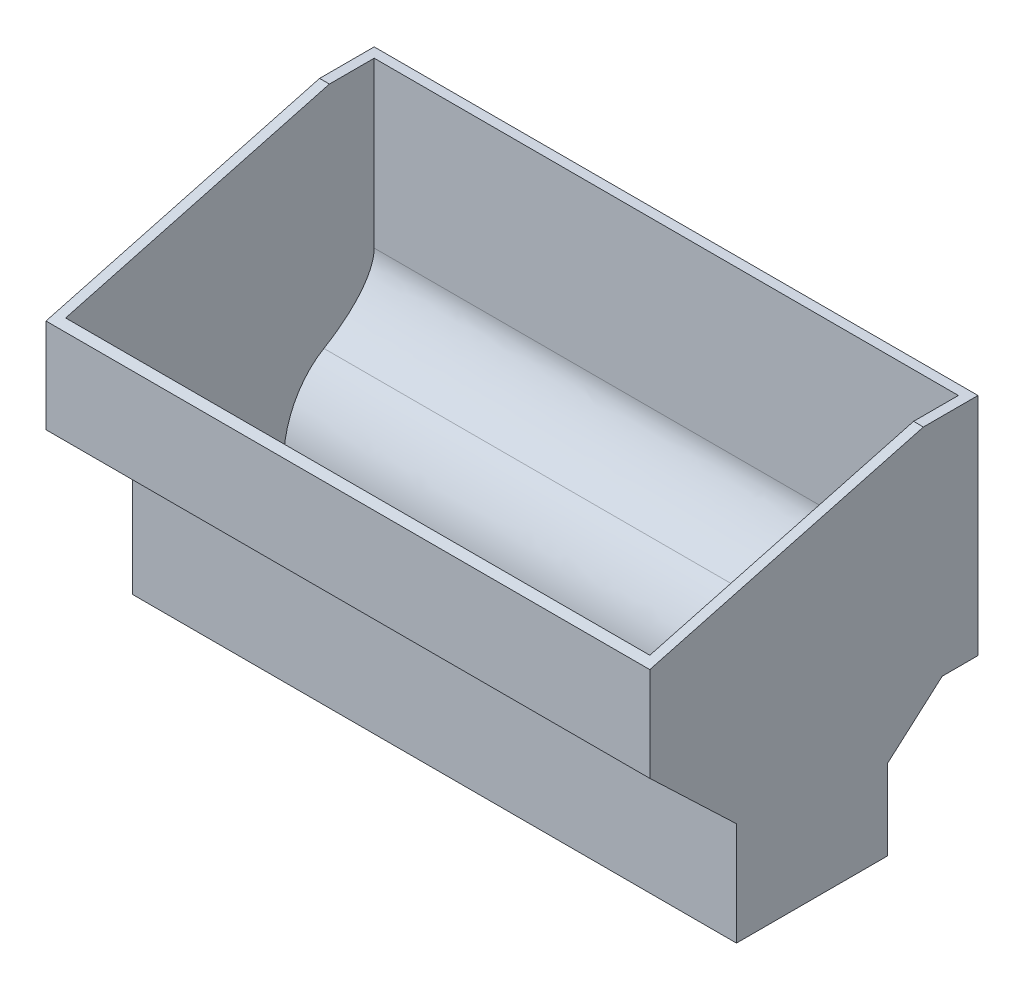
from build123d import *

# Parameters (mm, degrees)
SKIZZE1_W                       = 800
SKIZZE1_H                       = 200
AUFSATZ_LINEAR_AUSTRAGEN1_DEPTH = 274
SKIZZE2_W                       = 15
SKIZZE2_H                       = 170
AUFSATZ_LINEAR_AUSTRAGEN2_DEPTH = 6
AUFSATZ_LINEAR_AUSTRAGEN4_DEPTH = 800
SKIZZE8_W                       = 774
SKIZZE8_H                       = 408.84
SCHNITT_LINEAR_AUSTRAGEN3_DEPTH = 217
SKIZZE9_W                       = 774
SKIZZE9_H                       = 294
SCHNITT_LINEAR_AUSTRAGEN4_DEPTH = 71
SKIZZE10_W                      = 774
SKIZZE10_H                      = 174
SCHNITT_LINEAR_AUSTRAGEN5_DEPTH = 170
VERRUNDUNG1_SIZE                = 115
VERRUNDUNG1_SIZE_2              = 95
VERRUNDUNG2_SIZE                = 95
VERRUNDUNG2_SIZE_2              = 115
VERRUNDUNG3_START               = -371
VERRUNDUNG3_DEPTH               = 776


with BuildPart() as part:
    # Skizze1 → Aufsatz-Linear austragen1 (new body)
    with BuildSketch(Plane(origin=(0, 0, 0), x_dir=(1, 0, 0), z_dir=(0, 1, 0))):
        with Locations((17.371106882, 37.147335423)):
            Rectangle(SKIZZE1_W, SKIZZE1_H)
    extrude(amount=AUFSATZ_LINEAR_AUSTRAGEN1_DEPTH)

    # Skizze2 → Aufsatz-Linear austragen2 (add)
    with BuildSketch(Plane(origin=(0, 0, 0), x_dir=(-1, 0, 0), z_dir=(0, -1, 0))):
        with Locations((340.128893118, 37.147335423)):
            Rectangle(SKIZZE2_W, SKIZZE2_H)
        with Locations((-344.871106882, 37.147335423)):
            Rectangle(SKIZZE2_W, SKIZZE2_H)
    extrude(amount=AUFSATZ_LINEAR_AUSTRAGEN2_DEPTH)

    # Skizze7 → Aufsatz-Linear austragen4 (add)
    with BuildSketch(Plane.ZY.offset(382.628893118)):
        Polygon((-137.147335423, 106.095397632), (-209.709609496, 169.941826261), (-257.147335423, 169.941826261), (-257.147335423, 468.401582256), (-184.807335423, 468.401582256), (177.692664577, 371.27), (177.692664577, 246.474221491), (62.852664577, 137), align=None)
    extrude(amount=-AUFSATZ_LINEAR_AUSTRAGEN4_DEPTH)

    # Skizze8 → Schnitt-Linear austragen3 (cut)
    with BuildSketch(Plane(origin=(0, 468.401582256, 0), x_dir=(1, 0, 0), z_dir=(0, 1, 0))):
        with Locations((17.371106882, 39.727335423)):
            Rectangle(SKIZZE8_W, SKIZZE8_H)
    extrude(amount=-SCHNITT_LINEAR_AUSTRAGEN3_DEPTH, mode=Mode.SUBTRACT)

    # Skizze9 → Schnitt-Linear austragen4 (cut)
    with BuildSketch(Plane(origin=(0, 251.401582256, 0), x_dir=(1, 0, 0), z_dir=(0, 1, 0))):
        with Locations((17.371106882, 97.147335423)):
            Rectangle(SKIZZE9_W, SKIZZE9_H)
    extrude(amount=-SCHNITT_LINEAR_AUSTRAGEN4_DEPTH, mode=Mode.SUBTRACT)

    # Skizze10 → Schnitt-Linear austragen5 (cut)
    with BuildSketch(Plane(origin=(0, 180.401582256, 0), x_dir=(1, 0, 0), z_dir=(0, 1, 0))):
        with Locations((17.371106882, 37.147335423)):
            Rectangle(SKIZZE10_W, SKIZZE10_H)
    extrude(amount=-SCHNITT_LINEAR_AUSTRAGEN5_DEPTH, mode=Mode.SUBTRACT)

    # Verrundung1
    # a fillet whose section is not a circle: 115, 95 mm, written as the material it takes off along each edge
    with BuildSketch(Plane(origin=(-369.628893118, 180.401582256, -124.147335423), x_dir=(0, -1, 0), z_dir=(1, 0, 0))) as verrundung1_piece_1:
        with BuildLine():
            Bezier((VERRUNDUNG1_SIZE, 0), (0, 0), (0, VERRUNDUNG1_SIZE_2), weights=[1, 0.707106781, 1])
            Line((0, VERRUNDUNG1_SIZE_2), (0, 0))
            Line((0, 0), (VERRUNDUNG1_SIZE, 0))
        make_face()
    extrude(amount=774, mode=Mode.SUBTRACT)

    # Verrundung2
    # a fillet whose section is not a circle: 115, 95 mm, written as the material it takes off along each edge
    with BuildSketch(Plane(origin=(-369.628893118, 251.401582256, 49.852664577), x_dir=(0, 0, 1), z_dir=(1, 0, 0))) as verrundung2_piece_1:
        with BuildLine():
            Bezier((VERRUNDUNG2_SIZE, 0), (0, 0), (0, VERRUNDUNG2_SIZE_2), weights=[1, 0.707106781, 1])
            Line((0, VERRUNDUNG2_SIZE_2), (0, 0))
            Line((0, 0), (VERRUNDUNG2_SIZE, 0))
        make_face()
    extrude(amount=774, mode=Mode.SUBTRACT)

    # Verrundung3: read off the stored shape, not the designer's step
    # Verrundung3 outline → Verrundung3 (add)
    with BuildSketch(Plane.YZ.offset(VERRUNDUNG3_START)):
        with BuildLine():
            add(Edge.make_bspline(
                [(251.401582257, 144.852664577), (251.401582257, 121.417687853), (238.208250652, 100.671279991)],
                knots=[0, 0, 0, 0.316521674, 0.316521674, 0.316521674], degree=2, weights=[1, 0.907292948, 0.873273479]))
            add(Edge.make_bspline(
                [(238.208250652, 100.671279991), (278.921580984, 164.69266458), (318.371713455, 164.692664577)],
                knots=[0, 0, 0, 1, 1, 1], degree=2, weights=[1, 0.876532088, 1]))
            Line((318.371713455, 164.692664577), (251.401582251, 164.692664573))
            Line((251.401582251, 164.692664573), (251.401582257, 144.852664577))
        make_face()
        with BuildLine():
            Line((180.401582251, -244.147335419), (250.535882306, -244.147335423))
            add(Edge.make_bspline(
                [(250.535882306, -244.147335423), (208.142607951, -244.147335414), (168.747010016, -177.475177999)],
                knots=[0, 0, 0, 1, 1, 1], degree=2, weights=[1, 0.868537314, 1]))
            add(Edge.make_bspline(
                [(168.747010016, -177.475177999), (180.401582257, -197.199094267), (180.401582257, -219.147335423)],
                knots=[0.70180493, 0.70180493, 0.70180493, 1, 1, 1], degree=2, weights=[0.877409678, 0.912660686, 1]))
            Line((180.401582257, -219.147335423), (180.401582251, -244.147335419))
        make_face()
    extrude(amount=VERRUNDUNG3_DEPTH)


solid = part.part
